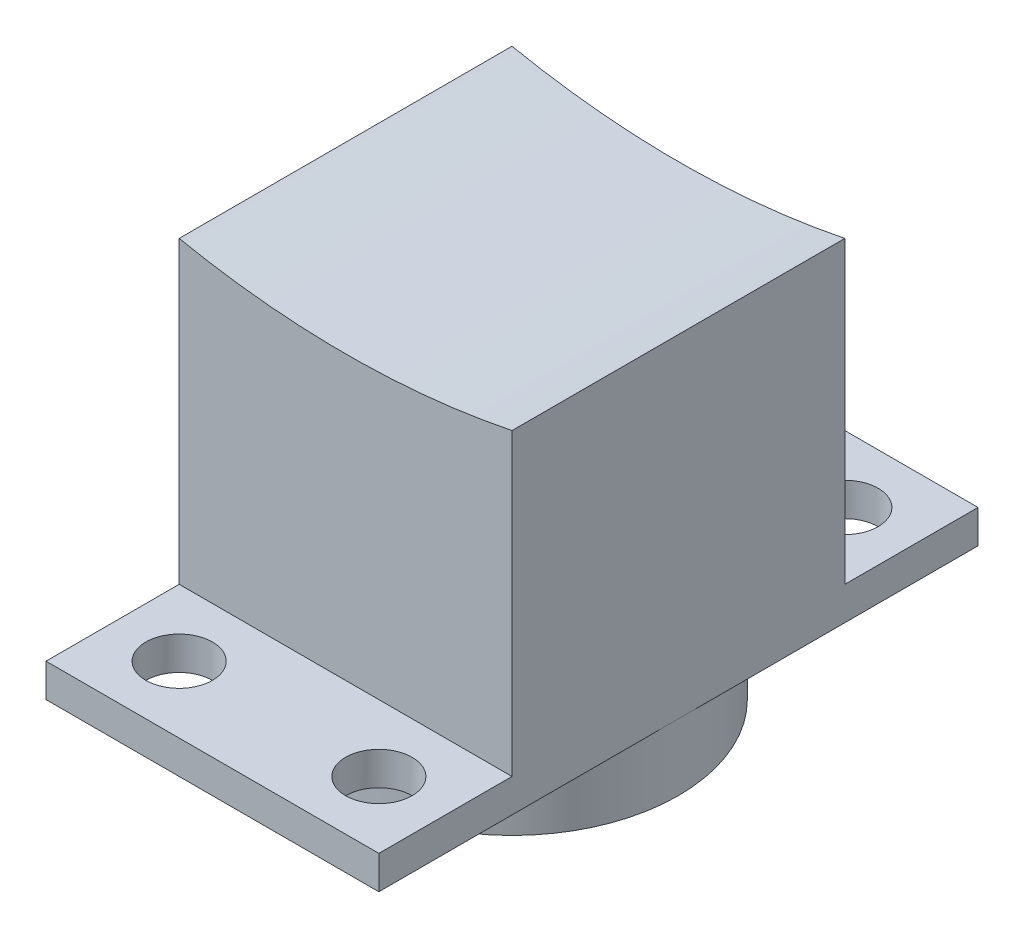
from build123d import *

# Parameters (mm, degrees)
BOSS_EXTRUDE1_DEPTH      = 50
SKETCH2_R                = 25
BOSS_EXTRUDE2_DEPTH      = 10
BOSS_EXTRUDE3_DEPTH      = 20
BOSS_EXTRUDE3_DEPTH_BACK = 70
SKETCH3_W                = 50
SKETCH3_H                = 5
SKETCH4_R                = 5
CUT_EXTRUDE1_DEPTH       = 10


with BuildPart() as part:
    # Sketch1 → Boss-Extrude1 (new body)
    with BuildSketch(Plane.XY):
        with BuildLine():
            Line((25, 25), (25, -25))
            Line((25, -25), (-25, -25))
            Line((-25, -25), (-25, 25))
            ThreePointArc((-25, 25), (0, 22.474363409), (25, 25))
        make_face()
    extrude(amount=BOSS_EXTRUDE1_DEPTH)

    # Sketch2 → Boss-Extrude2 (add)
    with BuildSketch(Plane.XZ.offset(25)):
        with Locations((0, 25)):
            Circle(SKETCH2_R)
    extrude(amount=BOSS_EXTRUDE2_DEPTH)

    # Sketch3 → Boss-Extrude3 (add, two sides: drawn at the far end of the back side and taken through both)
    with BuildSketch(Plane.XY.offset(50).offset(-BOSS_EXTRUDE3_DEPTH_BACK)):
        with Locations((0, -22.5)):
            Rectangle(SKETCH3_W, SKETCH3_H)
    extrude(amount=BOSS_EXTRUDE3_DEPTH + BOSS_EXTRUDE3_DEPTH_BACK)

    # Sketch4 → Cut-Extrude1 (cut)
    with BuildSketch(Plane(origin=(0, -20, 0), x_dir=(1, 0, 0), z_dir=(0, 1, 0))):
        with Locations((-15, -60)):
            Circle(SKETCH4_R)
        with Locations((15, -60)):
            Circle(SKETCH4_R)
        with Locations((15, 10)):
            Circle(SKETCH4_R)
        with Locations((-15, 10)):
            Circle(SKETCH4_R)
    extrude(amount=-CUT_EXTRUDE1_DEPTH, mode=Mode.SUBTRACT)


solid = part.part
